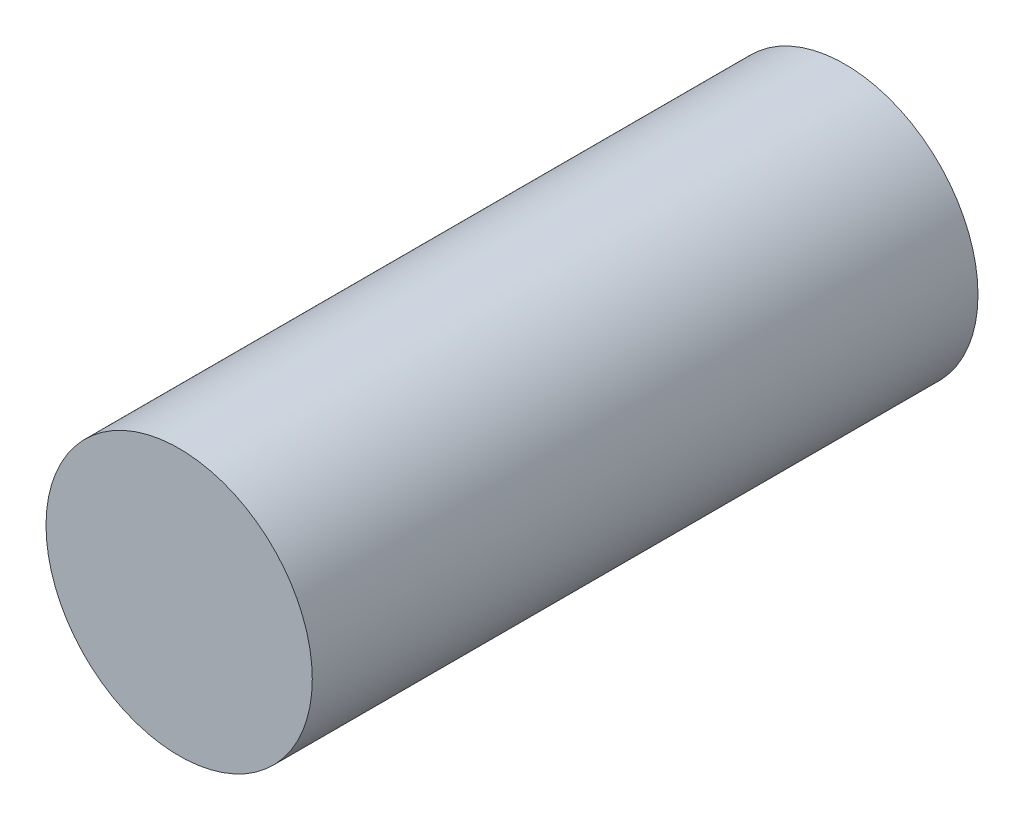
from build123d import *

# Parameters (mm, degrees)
SKETCH_1_R      = 40
EXTRUDE_1_DEPTH = 200


with BuildPart() as part:
    # 草图1 → 凸台-拉伸1 (new body)
    with BuildSketch(Plane.XY):
        Circle(SKETCH_1_R)
    extrude(amount=EXTRUDE_1_DEPTH)


solid = part.part
